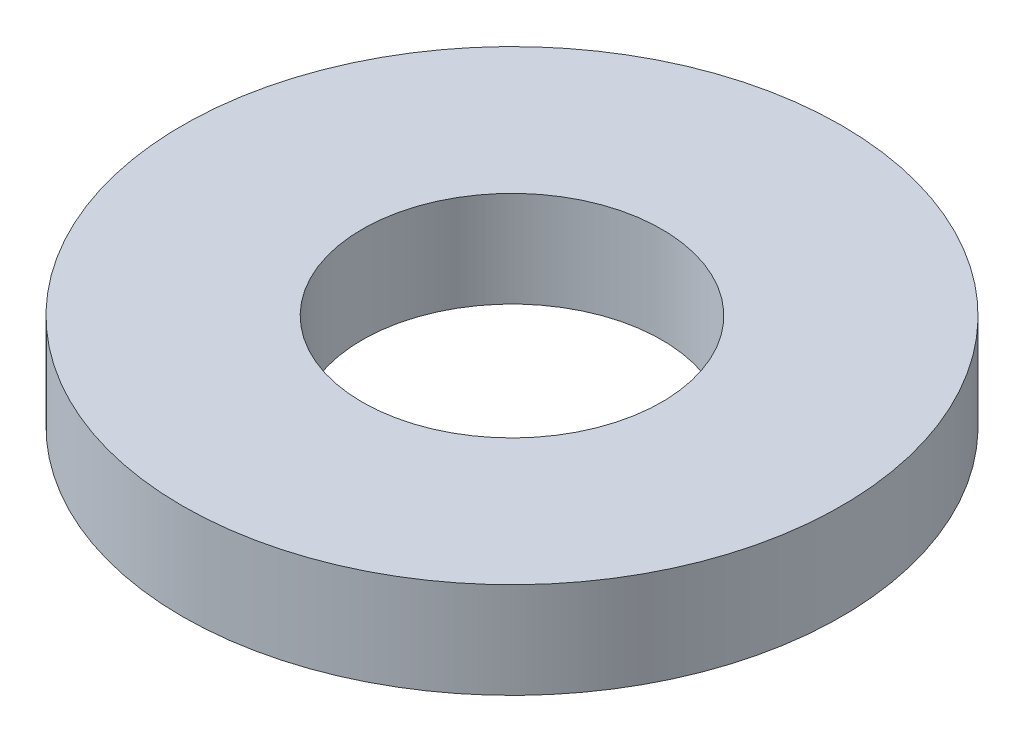
from build123d import *

# Parameters (mm, degrees)
SKETCH1_R           = 82.5
BOSS_EXTRUDE1_DEPTH = 24
SKETCH2_R           = 37.5
CUT_EXTRUDE1_DEPTH  = 120.115490177


with BuildPart() as part:
    # Sketch1 → Boss-Extrude1 (new body)
    with BuildSketch(Plane(origin=(0, 0, 0), x_dir=(1, 0, 0), z_dir=(0, 1, 0))):
        Circle(SKETCH1_R)
    extrude(amount=BOSS_EXTRUDE1_DEPTH)

    # Sketch2 → Cut-Extrude1 (cut, through all)
    with BuildSketch(Plane(origin=(0, 0, 0), x_dir=(1, 0, 0), z_dir=(0, 1, 0))):
        Circle(SKETCH2_R)
    extrude(amount=CUT_EXTRUDE1_DEPTH, mode=Mode.SUBTRACT)


solid = part.part
